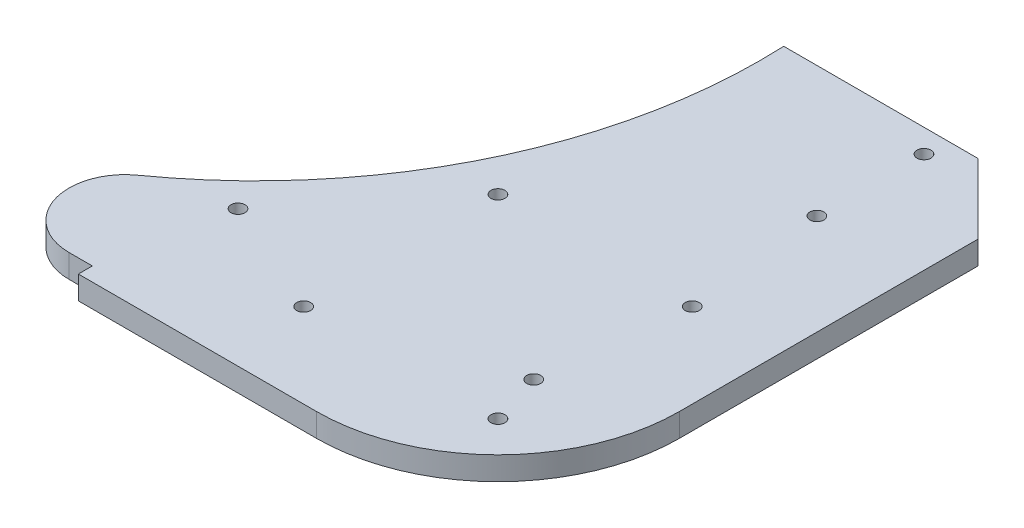
from build123d import *

# Parameters (mm, degrees)
BOSS_EXTRU_1_DEPTH      = 5
ESQUISSE2_R             = 1.5
ENL_V_MAT_EXTRU_1_DEPTH = 105.483064759
ESQUISSE3_R             = 1.5
ENL_V_MAT_EXTRU_2_DEPTH = 105.483064759


with BuildPart() as part:
    # Esquisse1 → Boss.-Extru.1 (new body)
    with BuildSketch(Plane(origin=(0, 0, 0), x_dir=(1, 0, 0), z_dir=(0, 1, 0))):
        with BuildLine():
            Line((-51.1, -39), (0, -39))
            ThreePointArc((0, -39), (27.577164466, -27.577164466), (39, 0))
            Line((39, 0), (39, 64.082873123))
            Line((39, 64.082873123), (24, 79.082873123))
            Line((24, 79.082873123), (-17.715268603, 79.082873123))
            ThreePointArc((-17.715268603, 79.082873123), (-28.51615758, 26.652464115), (-63.070954357, -14.232410975))
            ThreePointArc((-63.070954357, -14.232410975), (-67.528277829, -27.659845058), (-56.1, -36))
            Line((-56.1, -36), (-51.1, -36))
            Line((-51.1, -36), (-51.1, -39))
        make_face()
    extrude(amount=BOSS_EXTRU_1_DEPTH)

    # Esquisse2 → Enlèv. mat.-Extru.1 (cut, through all)
    with BuildSketch(Plane.XZ):
        with Locations((20.859650045, 20.859650045)):
            Circle(ESQUISSE2_R)
        with Locations((20.859650045, -20.859650045)):
            Circle(ESQUISSE2_R)
        with Locations((-20.859650045, -20.859650045)):
            Circle(ESQUISSE2_R)
        with Locations((-20.859650045, 20.859650045)):
            Circle(ESQUISSE2_R)
        with Locations((17.4, -74.082873123)):
            Circle(ESQUISSE2_R)
        with Locations((17.4, 9.717126877)):
            Circle(ESQUISSE2_R)
    extrude(amount=-ENL_V_MAT_EXTRU_1_DEPTH, mode=Mode.SUBTRACT)

    # Esquisse3 → Enlèv. mat.-Extru.2 (cut, through all)
    with BuildSketch(Plane(origin=(0, 5, 0), x_dir=(1, 0, 0), z_dir=(0, 1, 0))):
        with Locations((17.4, 51.082873123)):
            Circle(ESQUISSE3_R)
        with Locations((-46.1, -9.717126877)):
            Circle(ESQUISSE3_R)
    extrude(amount=-ENL_V_MAT_EXTRU_2_DEPTH, mode=Mode.SUBTRACT)


solid = part.part
